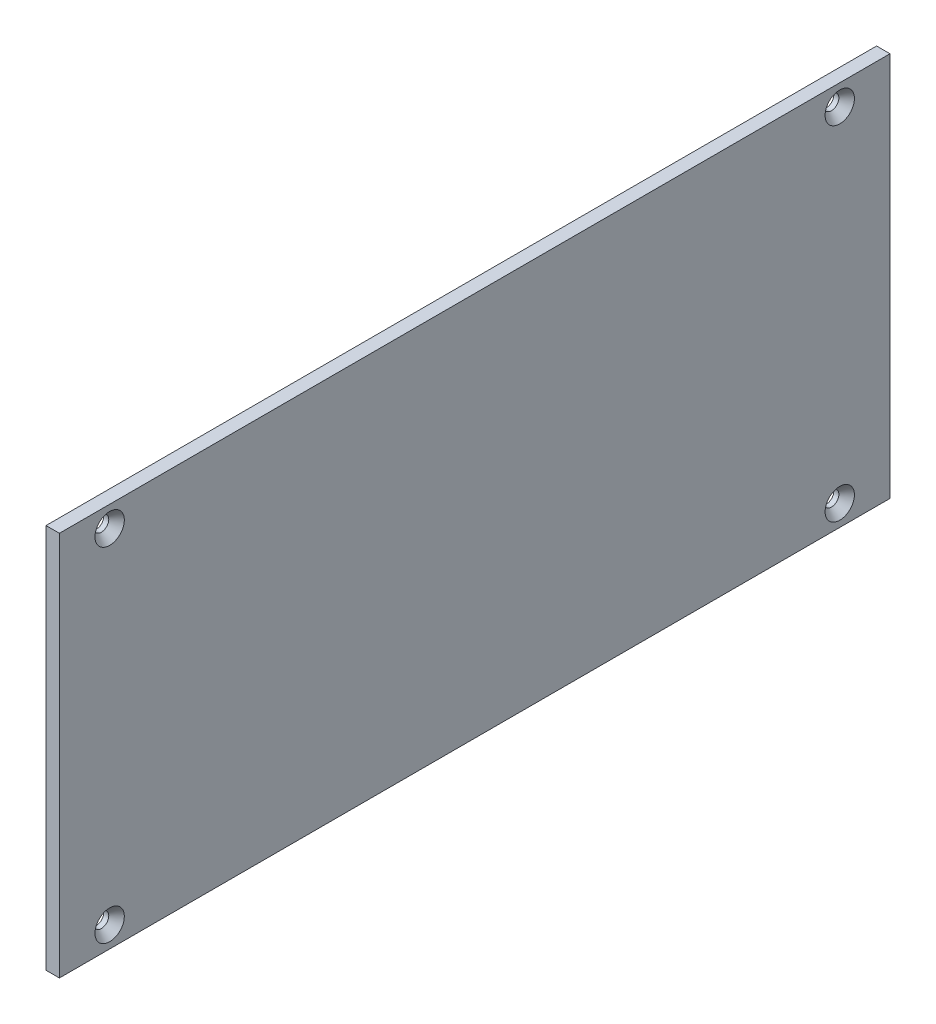
from build123d import *

# Parameters (mm, degrees)
SKETCH1_W                                     = 99.2004
SKETCH1_H                                     = 46
BOSS_EXTRUDE1_DEPTH                           = 1.6002
CSK_FOR_0_FLAT_HEAD_SOCKET_CAP_SCREW1_A_COUNT = 2
CSK_FOR_0_FLAT_HEAD_SOCKET_CAP_SCREW1_A_PITCH = 41
CSK_FOR_0_FLAT_HEAD_SOCKET_CAP_SCRE_2_COUNT   = 2
CSK_FOR_0_FLAT_HEAD_SOCKET_CAP_SCRE_2_PITCH   = 96.358236597
CSK_FOR_0_FLAT_HEAD_SOCKET_CAP_SCRE_3_COUNT   = 2
CSK_FOR_0_FLAT_HEAD_SOCKET_CAP_SCRE_3_PITCH   = 87.2004


with BuildPart() as part:
    # Sketch1 → Boss-Extrude1 (new body)
    with BuildSketch(Plane(origin=(0, 0, 0), x_dir=(0, 0, -1), z_dir=(1, 0, 0))):
        with Locations((49.6002, 23)):
            Rectangle(SKETCH1_W, SKETCH1_H)
    extrude(amount=BOSS_EXTRUDE1_DEPTH)

    # Sketch4 → CSK for #0 Flat Head Socket Cap Screw1 (revolve, cut)
    with BuildSketch(Plane(origin=(1.6002, 43.5, -6), x_dir=(0, 0, -1), z_dir=(0, 1, 0))):
        Polygon((0, 0), (0, 1.6002), (0.889, 1.6002), (0.889, 0.993458156), (1.7526, 0), align=None)
    csk_for_0_flat_head_socket_cap_screw1 = revolve(axis=Axis((7.9502, 43.5, -6), (-1, 0, 0)), mode=Mode.SUBTRACT)

    # CSK for #0 Flat Head Socket Cap Screw1 a: CSK for #0 Flat Head Socket Cap Screw1 ×2
    with Locations(*[(0, -i * CSK_FOR_0_FLAT_HEAD_SOCKET_CAP_SCREW1_A_PITCH, 0) for i in range(1, CSK_FOR_0_FLAT_HEAD_SOCKET_CAP_SCREW1_A_COUNT)]):
        add(csk_for_0_flat_head_socket_cap_screw1, mode=Mode.SUBTRACT)

    # CSK for _0 Flat Head Socket Cap Scre 2: CSK for #0 Flat Head Socket Cap Screw1 ×2
    with Locations(*[Vector(0, -0.42549554088775676, -0.9049605210641155) * (i * CSK_FOR_0_FLAT_HEAD_SOCKET_CAP_SCRE_2_PITCH) for i in range(1, CSK_FOR_0_FLAT_HEAD_SOCKET_CAP_SCRE_2_COUNT)]):
        add(csk_for_0_flat_head_socket_cap_screw1, mode=Mode.SUBTRACT)

    # CSK for _0 Flat Head Socket Cap Scre 3: CSK for #0 Flat Head Socket Cap Screw1 ×2
    with Locations(*[(0, 0, -i * CSK_FOR_0_FLAT_HEAD_SOCKET_CAP_SCRE_3_PITCH) for i in range(1, CSK_FOR_0_FLAT_HEAD_SOCKET_CAP_SCRE_3_COUNT)]):
        add(csk_for_0_flat_head_socket_cap_screw1, mode=Mode.SUBTRACT)


solid = part.part
